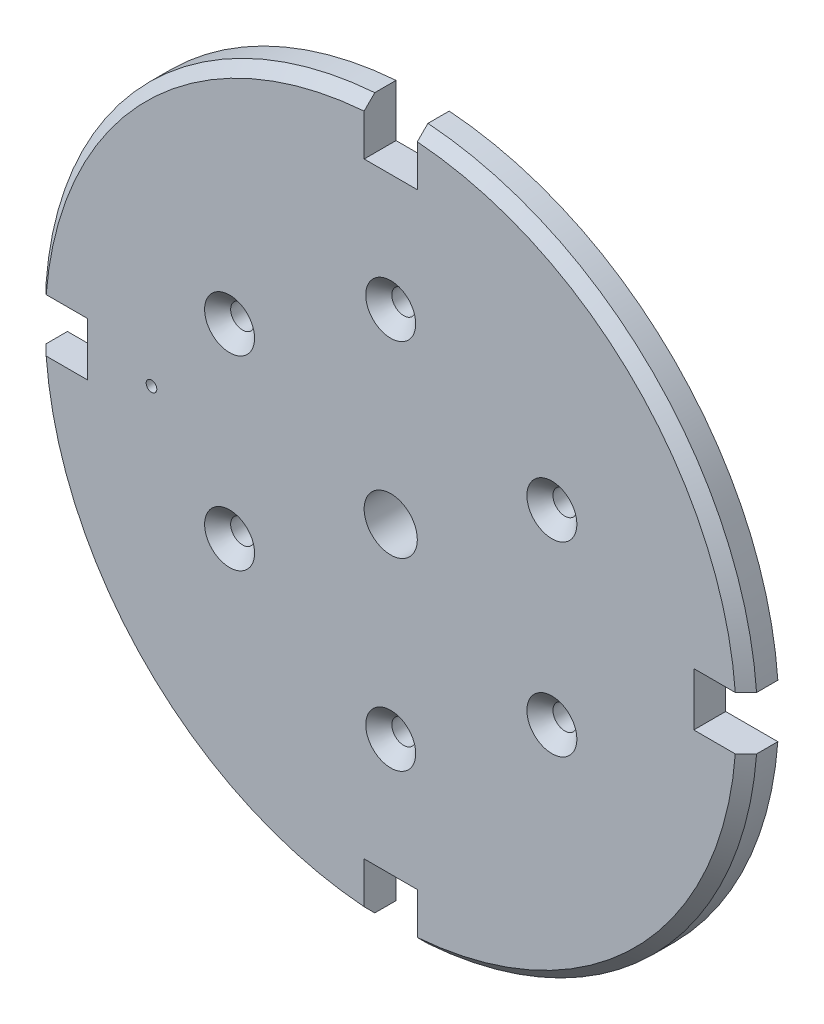
from build123d import *

# Parameters (mm, degrees)
SZKIC1_R                                             = 67
DODANIE_WYCI_GNI_CIE1_DEPTH                          = 6
SFAZOWANIE1_SIZE                                     = 2
OTWORY_USTALAJ_CE_10_0MM1_D                          = 10
OTWORY_USTALAJ_CE_10_0MM1_DEPTH                      = 6
OTWORY_USTALAJ_CE_10_0MM1_TIP                        = 3.004303095
WYTNIJ_WYCI_GNI_CIE1_REACH                           = 96.942
SZKIC7_R                                             = 2.05
SZYK_KO_OWY2_COUNT                                   = 6
SZKIC8_R                                             = 1
WYTNIJ_WYCI_GNI_CIE2_DEPTH                           = 20
SZKIC9_W                                             = 10
SZKIC9_H                                             = 10
WYTNIJ_WYCI_GNI_CIE3_DEPTH                           = 10
SZYK_KO_OWY3_COUNT                                   = 4
POG_BIENIE_STO_KOWE_POD_M4_WKR_T_DO_CZ_C_D           = 4.5
POG_BIENIE_STO_KOWE_POD_M4_WKR_T_DO_CZ_C_CSINK_D     = 9.4
POG_BIENIE_STO_KOWE_POD_M4_WKR_T_DO_CZ_C_CSINK_ANGLE = 90
SZYK_KO_OWY4_COUNT                                   = 6
DODANIE_WYCI_GNI_CIE2_START                          = 15
SZKIC15_R                                            = 9
SZKIC15_R_2                                          = 5
DODANIE_WYCI_GNI_CIE2_DEPTH                          = 15
WYTNIJ_WYCI_GNI_CIE4_REACH                           = 97.671
WYTNIJ_WYCI_GNI_CIE4_END_RADIUS                      = 9
SZKIC16_R                                            = 0.75
SZYK_KO_OWY5_COUNT                                   = 6
WYTNIJ_WYCI_GNI_CIE5_REACH                           = 97.671
WYTNIJ_WYCI_GNI_CIE5_END_RADIUS                      = 9
SZKIC17_R                                            = 0.75
SZYK_KO_OWY6_COUNT                                   = 6


with BuildPart() as part:
    # Szkic1 → Dodanie-wyciągnięcie1 (new body)
    with BuildSketch(Plane.XY):
        Circle(SZKIC1_R)
    extrude(amount=DODANIE_WYCI_GNI_CIE1_DEPTH)

    # Sfazowanie1
    sfazowanie1_edges = [part.edges().sort_by_distance(p)[0] for p in [
        (-67, 0, 6),
    ]]
    chamfer(sfazowanie1_edges, length=SFAZOWANIE1_SIZE)

    # Otwory ustalające Ø10.0mm1
    with Locations(Plane.XY.offset(6)):
        with Locations((0, 0)):
            Hole(OTWORY_USTALAJ_CE_10_0MM1_D / 2, depth=OTWORY_USTALAJ_CE_10_0MM1_DEPTH)
            with Locations((0, 0, -(OTWORY_USTALAJ_CE_10_0MM1_DEPTH + OTWORY_USTALAJ_CE_10_0MM1_TIP / 2))):  # 118° drill point
                Cone(0, OTWORY_USTALAJ_CE_10_0MM1_D / 2, OTWORY_USTALAJ_CE_10_0MM1_TIP, mode=Mode.SUBTRACT)

    # Szkic7 → Wytnij-wyciągnięcie1 (cut, up to next)
    with BuildSketch(Plane.XY.offset(6), mode=Mode.PRIVATE) as wytnij_wyci_gni_cie1_sk1:
        with Locations((0, 35)):
            Circle(SZKIC7_R)
    wytnij_wyci_gni_cie1_tool1 = extrude(wytnij_wyci_gni_cie1_sk1.sketch, amount=-WYTNIJ_WYCI_GNI_CIE1_REACH, mode=Mode.PRIVATE) & part.part
    wytnij_wyci_gni_cie1 = wytnij_wyci_gni_cie1_tool1.solids().sort_by_distance((0, 35, 6))[0]
    add(wytnij_wyci_gni_cie1, mode=Mode.SUBTRACT)

    # Szyk kołowy2: Wytnij-wyciągnięcie1 ×6 about axis
    szyk_ko_owy2_axis = Axis((0, 0, 12.200873246), (0, 0, -1))
    for i in range(1, SZYK_KO_OWY2_COUNT):
        add(wytnij_wyci_gni_cie1.rotate(szyk_ko_owy2_axis, i * 360 / SZYK_KO_OWY2_COUNT), mode=Mode.SUBTRACT)

    # Szkic8 → Wytnij-wyciągnięcie2 (cut, symmetric)
    with BuildSketch(Plane.XY.offset(6)):
        with Locations((-45, 0)):
            Circle(SZKIC8_R)
    extrude(amount=WYTNIJ_WYCI_GNI_CIE2_DEPTH, both=True, mode=Mode.SUBTRACT)

    # Szkic9 → Wytnij-wyciągnięcie3 (cut)
    with BuildSketch(Plane.XY.offset(6)):
        with Locations((62, 0)):
            Rectangle(SZKIC9_W, SZKIC9_H)
    wytnij_wyci_gni_cie3 = extrude(amount=-WYTNIJ_WYCI_GNI_CIE3_DEPTH, mode=Mode.SUBTRACT)

    # Szyk kołowy3: Wytnij-wyciągnięcie3 ×4 about axis
    szyk_ko_owy3_axis = Axis((0, 0, 6), (0, 0, 1))
    for i in range(1, SZYK_KO_OWY3_COUNT):
        add(wytnij_wyci_gni_cie3.rotate(szyk_ko_owy3_axis, i * 360 / SZYK_KO_OWY3_COUNT), mode=Mode.SUBTRACT)

    # Pogłębienie stożkowe pod M4 wkręt do części metalowych z łbem soczewkowym1 (through all)
    with Locations(Plane(origin=(0, 35, 6), x_dir=(1, 0, 0), z_dir=(0, 0, 1))):
        with Locations((0, 0)):
            pog_bienie_sto_kowe_pod_m4_wkr_t_do_cz_c = CounterSinkHole(POG_BIENIE_STO_KOWE_POD_M4_WKR_T_DO_CZ_C_D / 2, POG_BIENIE_STO_KOWE_POD_M4_WKR_T_DO_CZ_C_CSINK_D / 2, counter_sink_angle=POG_BIENIE_STO_KOWE_POD_M4_WKR_T_DO_CZ_C_CSINK_ANGLE)

    # Szyk kołowy4: Pogłębienie stożkowe pod M4 wkręt do części metalowych z łbem soczewkowym1 ×6 about axis
    szyk_ko_owy4_axis = Axis((0, 0, 12.200873246), (0, 0, -1))
    for i in range(1, SZYK_KO_OWY4_COUNT):
        add(pog_bienie_sto_kowe_pod_m4_wkr_t_do_cz_c.rotate(szyk_ko_owy4_axis, i * 360 / SZYK_KO_OWY4_COUNT), mode=Mode.SUBTRACT)

    # Szkic15 → Dodanie-wyciągnięcie2 (add)
    with BuildSketch(Plane(origin=(0, 0, 0), x_dir=(-1, 0, 0), z_dir=(0, 0, -1)).offset(DODANIE_WYCI_GNI_CIE2_START)):
        Circle(SZKIC15_R)
        Circle(SZKIC15_R_2, mode=Mode.SUBTRACT)
    extrude(amount=-DODANIE_WYCI_GNI_CIE2_DEPTH)

    # Wytnij-wyciągnięcie4: up to this cylinder (the profile starts inside it)
    wytnij_wyci_gni_cie4_end = Plane(origin=(0, 0, -7.5), z_dir=(0, 0, 1)) * Cylinder(WYTNIJ_WYCI_GNI_CIE4_END_RADIUS, 219.342, mode=Mode.PRIVATE)
    # Szkic16 → Wytnij-wyciągnięcie4 (cut, up to the surface)
    with BuildSketch(Plane(origin=(0, 0, 0), x_dir=(1, 0, 0), z_dir=(0, 1, 0)), mode=Mode.PRIVATE) as wytnij_wyci_gni_cie4_sk1:
        with Locations((-4, 10)):
            Circle(SZKIC16_R)
    wytnij_wyci_gni_cie4_tool1 = extrude(wytnij_wyci_gni_cie4_sk1.sketch, amount=WYTNIJ_WYCI_GNI_CIE4_REACH, mode=Mode.PRIVATE) & wytnij_wyci_gni_cie4_end
    # Szkic16 → Wytnij-wyciągnięcie4 (cut, up to the surface)
    with BuildSketch(Plane(origin=(0, 0, 0), x_dir=(1, 0, 0), z_dir=(0, 1, 0)), mode=Mode.PRIVATE) as wytnij_wyci_gni_cie4_sk2:
        with Locations((-4, 5)):
            Circle(SZKIC16_R)
    wytnij_wyci_gni_cie4_tool2 = extrude(wytnij_wyci_gni_cie4_sk2.sketch, amount=WYTNIJ_WYCI_GNI_CIE4_REACH, mode=Mode.PRIVATE) & wytnij_wyci_gni_cie4_end
    wytnij_wyci_gni_cie4 = wytnij_wyci_gni_cie4_tool1.solids().sort_by_distance((-4, 0, -10))[0] + wytnij_wyci_gni_cie4_tool2.solids().sort_by_distance((-4, 0, -5))[0]
    add(wytnij_wyci_gni_cie4, mode=Mode.SUBTRACT)

    # Szyk kołowy5: Wytnij-wyciągnięcie4 ×6 about axis
    szyk_ko_owy5_axis = Axis((0, 0, 12.200873246), (0, 0, -1))
    for i in range(1, SZYK_KO_OWY5_COUNT):
        add(wytnij_wyci_gni_cie4.rotate(szyk_ko_owy5_axis, i * 360 / SZYK_KO_OWY5_COUNT), mode=Mode.SUBTRACT)

    # Wytnij-wyciągnięcie5: up to this cylinder (the profile starts inside it)
    wytnij_wyci_gni_cie5_end = Plane(origin=(0, 0, -5), z_dir=(0, 0, 1)) * Cylinder(WYTNIJ_WYCI_GNI_CIE5_END_RADIUS, 219.342, mode=Mode.PRIVATE)
    # Szkic17 → Wytnij-wyciągnięcie5 (cut, up to the surface)
    with BuildSketch(Plane(origin=(0, 0, 0), x_dir=(0, 1, 0), z_dir=(-1, 0, 0)), mode=Mode.PRIVATE) as wytnij_wyci_gni_cie5_sk1:
        with Locations((-4, 7.5)):
            Circle(SZKIC17_R)
    wytnij_wyci_gni_cie5_tool1 = extrude(wytnij_wyci_gni_cie5_sk1.sketch, amount=WYTNIJ_WYCI_GNI_CIE5_REACH, mode=Mode.PRIVATE) & wytnij_wyci_gni_cie5_end
    # Szkic17 → Wytnij-wyciągnięcie5 (cut, up to the surface)
    with BuildSketch(Plane(origin=(0, 0, 0), x_dir=(0, 1, 0), z_dir=(-1, 0, 0)), mode=Mode.PRIVATE) as wytnij_wyci_gni_cie5_sk2:
        with Locations((-4, 2.5)):
            Circle(SZKIC17_R)
    wytnij_wyci_gni_cie5_tool2 = extrude(wytnij_wyci_gni_cie5_sk2.sketch, amount=WYTNIJ_WYCI_GNI_CIE5_REACH, mode=Mode.PRIVATE) & wytnij_wyci_gni_cie5_end
    wytnij_wyci_gni_cie5 = wytnij_wyci_gni_cie5_tool1.solids().sort_by_distance((0, -4, -7.5))[0] + wytnij_wyci_gni_cie5_tool2.solids().sort_by_distance((0, -4, -2.5))[0]
    add(wytnij_wyci_gni_cie5, mode=Mode.SUBTRACT)

    # Szyk kołowy6: Wytnij-wyciągnięcie5 ×6 about axis
    szyk_ko_owy6_axis = Axis((0, 0, 12.200873246), (0, 0, -1))
    for i in range(1, SZYK_KO_OWY6_COUNT):
        add(wytnij_wyci_gni_cie5.rotate(szyk_ko_owy6_axis, i * 360 / SZYK_KO_OWY6_COUNT), mode=Mode.SUBTRACT)


solid = part.part
